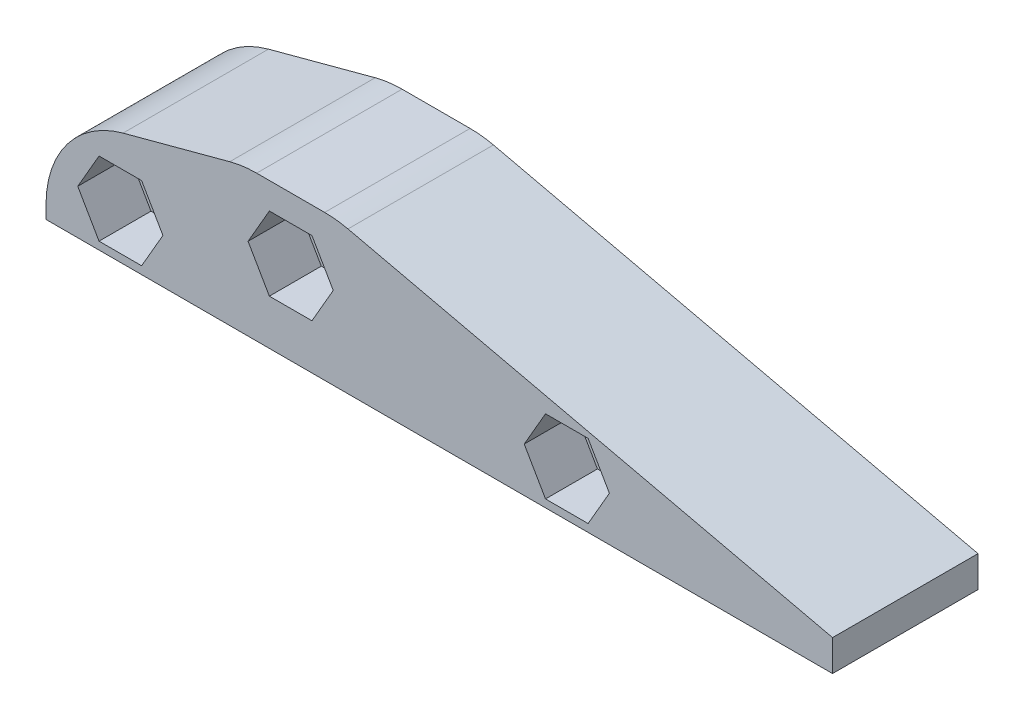
from build123d import *

# Parameters (mm, degrees)
BOSS_EXTRUDE1_DEPTH = 14
FILLET1_R           = 10
FILLET2_R           = 10
CUT_EXTRUDE1_DEPTH  = 5
SKETCH4_R           = 2.05
CUT_EXTRUDE2_DEPTH  = 78.515972824


with BuildPart() as part:
    # Sketch1 → Boss-Extrude1 (new body)
    with BuildSketch(Plane.XY):
        Polygon((0, 0), (0, 8.92), (18.958818102, 14), (27.958818102, 14), (75.708163648, 3), (75.708163648, 0), align=None)
    extrude(amount=BOSS_EXTRUDE1_DEPTH)

    # Fillet1
    fillet1_edges = [part.edges().sort_by_distance(p)[0] for p in [
        (0, 8.92, 7),
    ]]
    fillet(fillet1_edges, radius=FILLET1_R)

    # Fillet2
    fillet2_edges = [part.edges().sort_by_distance(p)[0] for p in [
        (27.958818102, 14, 7),
        (18.958818102, 14, 7),
    ]]
    fillet(fillet2_edges, radius=FILLET2_R)

    # Sketch3 → Cut-Extrude1 (cut)
    with BuildSketch(Plane.XY.offset(14)):
        Polygon((9.204597923, 0.743591352), (11.254191379, 4.293591352), (9.204597923, 7.843591352), (5.105411012, 7.843591352), (3.055817556, 4.293591352), (5.105411012, 0.743591352), align=None)
        Polygon((25.598194748, 4.356888356), (27.647788204, 7.906888356), (25.598194748, 11.456888356), (21.499007837, 11.456888356), (19.449414382, 7.906888356), (21.499007837, 4.356888356), align=None)
        Polygon((52.17923967, 0.743591352), (54.228833126, 4.293591352), (52.17923967, 7.843591352), (48.080052759, 7.843591352), (46.030459303, 4.293591352), (48.080052759, 0.743591352), align=None)
    extrude(amount=-CUT_EXTRUDE1_DEPTH, mode=Mode.SUBTRACT)

    # Sketch4 → Cut-Extrude2 (cut, through all)
    with BuildSketch(Plane.XY.offset(9)):
        with Locations((7.155004468, 4.293591352)):
            Circle(SKETCH4_R)
        with Locations((23.548601293, 7.906888356)):
            Circle(SKETCH4_R)
        with Locations((50.129646215, 4.293591352)):
            Circle(SKETCH4_R)
    extrude(amount=-CUT_EXTRUDE2_DEPTH, mode=Mode.SUBTRACT)


solid = part.part
